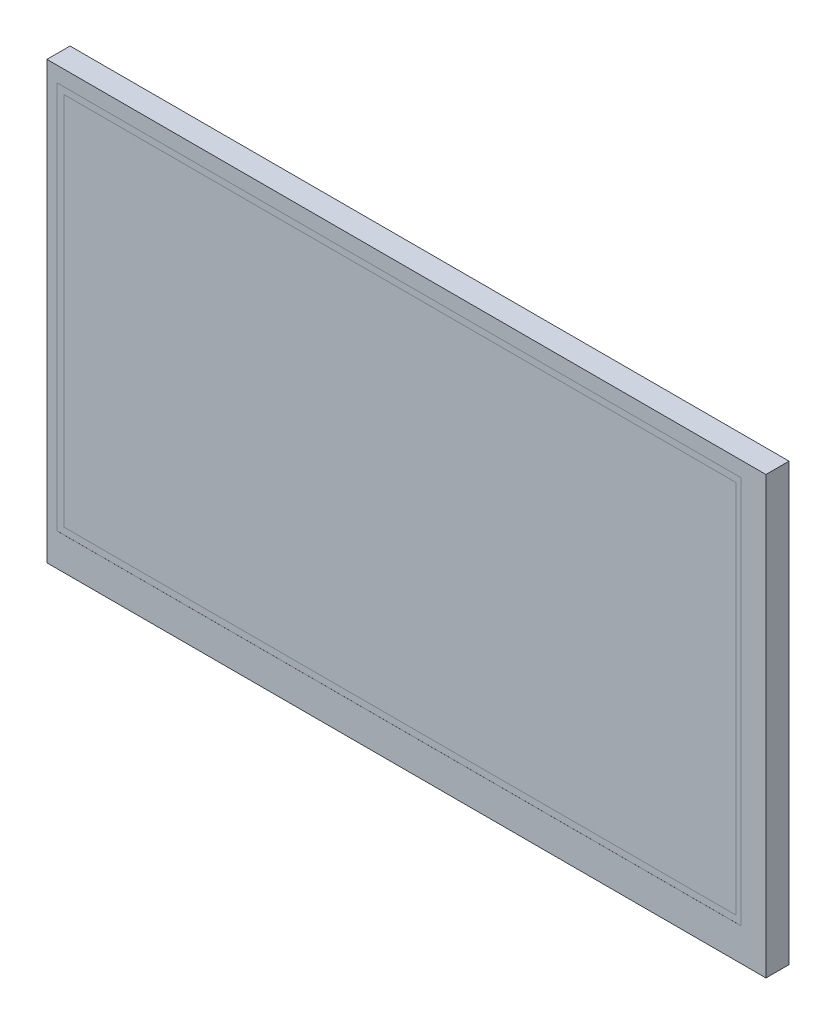
from build123d import *

# Parameters (mm, degrees)
SKETCH2_W                  = 180
SKETCH2_H                  = 104
PCB_DEPTH                  = 1.6
F_3_2_3_2_DIAMETER_HOLE1_D = 3.2
SKETCH5_W                  = 164.9
SKETCH5_H                  = 100
BEZEL_DEPTH                = 3.7
SKETCH6_W                  = 156.9
SKETCH6_H                  = 89
VISUAL_AREA_VA_DEPTH       = 0.01
F_1_0_1_DIAMETER_HOLE1_D   = 1
SKETCH12_W                 = 180
SKETCH12_H                 = 104
SKETCH12_W_2               = 164.9
SKETCH12_H_2               = 100
CUT_EXTRUDE1_DEPTH         = 105.077327022


with BuildPart() as part:
    # Sketch2 → PCB (new body)
    with BuildSketch(Plane.XY):
        Rectangle(SKETCH2_W, SKETCH2_H)
    extrude(amount=PCB_DEPTH)

    # Ø3.2 (3.2) Diameter Hole1 (through all)
    with Locations(Plane.XY.offset(1.6)):
        with Locations((-87, 49), (87, 49), (87, -49), (-87, -49)):
            Hole(F_3_2_3_2_DIAMETER_HOLE1_D / 2)

    # Sketch5 → Bezel (add)
    with BuildSketch(Plane.XY.offset(1.6)):
        Rectangle(SKETCH5_W, SKETCH5_H)
    extrude(amount=BEZEL_DEPTH)

    # Sketch6 → Visual Area (VA) (cut)
    with BuildSketch(Plane.XY.offset(5.3)):
        with Locations((-1.7, 2)):
            Rectangle(SKETCH6_W, SKETCH6_H)
    extrude(amount=-VISUAL_AREA_VA_DEPTH, mode=Mode.SUBTRACT)

    # Ø1.0 (1) Diameter Hole1 (through all)
    with Locations(Plane.XY.offset(1.6)):
        with Locations((88.5, -41.91), (85.96, -41.91), (85.96, -39.37), (85.96, -36.83), (85.96, -34.29), (88.5, -39.37), (88.5, -36.83), (88.5, -34.29), (88.5, -24.13), (85.96, -24.13), (85.96, -21.59), (85.96, -19.05), (85.96, -16.51), (85.96, -13.97), (85.96, -11.43), (85.96, -8.89), (85.96, -6.35), (85.96, -3.81), (85.96, -1.27), (85.96, 1.27), (85.96, 3.81), (85.96, 6.35), (85.96, 8.89), (85.96, 11.43), (85.96, 13.97), (85.96, 16.51), (85.96, 19.05), (85.96, 21.59), (85.96, 24.13), (88.5, -21.59), (88.5, -19.05), (88.5, -16.51), (88.5, -13.97), (88.5, -11.43), (88.5, -8.89), (88.5, -6.35), (88.5, -3.81), (88.5, -1.27), (88.5, 1.27), (88.5, 3.81), (88.5, 6.35), (88.5, 8.89), (88.5, 11.43), (88.5, 13.97), (88.5, 16.51), (88.5, 19.05), (88.5, 21.59), (88.5, 24.13), (88.5, 34.29), (85.96, 34.29), (85.96, 36.83), (85.96, 39.37), (85.96, 41.91), (88.5, 36.83), (88.5, 39.37), (88.5, 41.91)):
            Hole(F_1_0_1_DIAMETER_HOLE1_D / 2)

    # Sketch12 → Cut-Extrude1 (cut, through all)
    with BuildSketch(Plane.XY.offset(5.3)):
        Rectangle(SKETCH12_W, SKETCH12_H)
        Rectangle(SKETCH12_W_2, SKETCH12_H_2, mode=Mode.SUBTRACT)
    extrude(amount=-CUT_EXTRUDE1_DEPTH, mode=Mode.SUBTRACT)


solid = part.part
